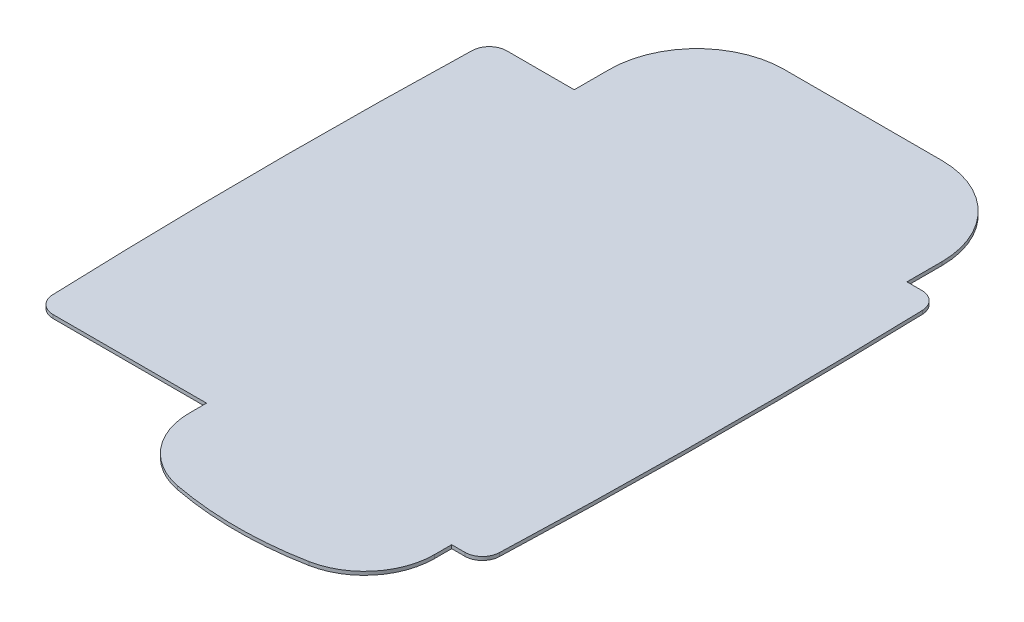
from build123d import *

# Parameters (mm, degrees)
EXTRUDE_1_DEPTH     = 0.5
SKETCH_3_W          = 25
SKETCH_3_H          = 35
CUT_EXTRUDE_1_DEPTH = 114.058613257
SKETCH_4_W          = 10
SKETCH_4_H          = 35
CUT_EXTRUDE_2_DEPTH = 114.058613257
SKETCH_5_W          = 50
SKETCH_5_H          = 20
CUT_EXTRUDE_3_DEPTH = 114.058613257
SKETCH_6_W          = 10
SKETCH_6_H          = 20
CUT_EXTRUDE_4_DEPTH = 114.058613257
EXTRUDE_2_DEPTH     = 0.5
CUT_EXTRUDE_5_DEPTH = 119.289418767
FILLET_1_R          = 5
FILLET_2_R          = 20


with BuildPart() as part:
    # ｽｹｯﾁ1 → ﾎﾞｽ - 押し出し1 (new, symmetric)
    with BuildSketch(Plane(origin=(0, 0, 0), x_dir=(1, 0, 0), z_dir=(0, 1, 0))):
        with BuildLine():
            Line((62.68888804, 92.5), (-62.68888804, 92.5))
            add(Edge.make_bspline(
                [(-62.68888804, 92.5), (-67.396314277, 0), (-62.68888804, -92.5)],
                knots=[4.444925752, 4.444925752, 4.444925752, 4.979852209, 4.979852209, 4.979852209], degree=2, weights=[1, 0.964444431, 1]))
            Line((-62.68888804, -92.5), (62.68888804, -92.5))
            add(Edge.make_bspline(
                [(62.68888804, -92.5), (67.396314277, 0), (62.68888804, 92.5)],
                knots=[1.303333099, 1.303333099, 1.303333099, 1.838259555, 1.838259555, 1.838259555], degree=2, weights=[1, 0.964444431, 1]))
        make_face()
    extrude(amount=EXTRUDE_1_DEPTH, both=True)

    # ｽｹｯﾁ3 → ｶｯﾄ - 押し出し1 (cut, through all)
    with BuildSketch(Plane(origin=(0, 0.5, 0), x_dir=(1, 0, 0), z_dir=(0, 1, 0))):
        with Locations((-52.5, 75)):
            Rectangle(SKETCH_3_W, SKETCH_3_H)
    extrude(amount=-CUT_EXTRUDE_1_DEPTH, mode=Mode.SUBTRACT)

    # ｽｹｯﾁ4 → ｶｯﾄ - 押し出し2 (cut, through all)
    with BuildSketch(Plane(origin=(0, 0.5, 0), x_dir=(1, 0, 0), z_dir=(0, 1, 0))):
        with Locations((60, 75)):
            Rectangle(SKETCH_4_W, SKETCH_4_H)
    extrude(amount=-CUT_EXTRUDE_2_DEPTH, mode=Mode.SUBTRACT)

    # ｽｹｯﾁ5 → ｶｯﾄ - 押し出し3 (cut, through all)
    with BuildSketch(Plane(origin=(0, 0.5, 0), x_dir=(1, 0, 0), z_dir=(0, 1, 0))):
        with Locations((-40, -82.5)):
            Rectangle(SKETCH_5_W, SKETCH_5_H)
    extrude(amount=-CUT_EXTRUDE_3_DEPTH, mode=Mode.SUBTRACT)

    # ｽｹｯﾁ6 → ｶｯﾄ - 押し出し4 (cut, through all)
    with BuildSketch(Plane(origin=(0, 0.5, 0), x_dir=(1, 0, 0), z_dir=(0, 1, 0))):
        with Locations((60, -82.5)):
            Rectangle(SKETCH_6_W, SKETCH_6_H)
    extrude(amount=-CUT_EXTRUDE_4_DEPTH, mode=Mode.SUBTRACT)

    # ｽｹｯﾁ7 → ﾎﾞｽ - 押し出し2 (add, symmetric)
    with BuildSketch(Plane(origin=(0, 0, 0), x_dir=(1, 0, 0), z_dir=(0, 1, 0))):
        with BuildLine():
            Line((-15, -92.5), (55, -92.5))
            ThreePointArc((55, -92.5), (20, -98.825030024), (-15, -92.5))
        make_face()
    extrude(amount=EXTRUDE_2_DEPTH, both=True)

    # ｽｹｯﾁ8 → ｶｯﾄ - 押し出し5 (cut, through all)
    with BuildSketch(Plane(origin=(0, 0.5, 0), x_dir=(1, 0, 0), z_dir=(0, 1, 0))):
        with BuildLine():
            Line((55, 67.5), (55, 92.5))
            Line((55, 92.5), (30, 92.5))
            ThreePointArc((30, 92.5), (47.67766953, 85.17766953), (55, 67.5))
        make_face()
        with BuildLine():
            ThreePointArc((-40, 67.5), (-32.677669545, 85.177669514), (-15.000000044, 92.5))
            Line((-15.000000044, 92.5), (-40, 92.5))
            Line((-40, 92.5), (-40, 67.5))
        make_face()
    extrude(amount=-CUT_EXTRUDE_5_DEPTH, mode=Mode.SUBTRACT)

    # ﾌｨﾚｯﾄ1
    fillet_1_edges = [part.edges().sort_by_distance(p)[0] for p in [
        (-64.116831739, -0.25, -57.5),
        (-63.590195865, -0.25, 72.5),
        (63.590195865, -0.2499997, 72.5),
        (64.116831739, -0.25, -57.5),
    ]]
    fillet(fillet_1_edges, radius=FILLET_1_R)

    # ﾌｨﾚｯﾄ2
    fillet_2_edges = [part.edges().sort_by_distance(p)[0] for p in [
        (-15, 0, 92.5),
        (55, 0, 92.5),
    ]]
    fillet(fillet_2_edges, radius=FILLET_2_R)


solid = part.part
